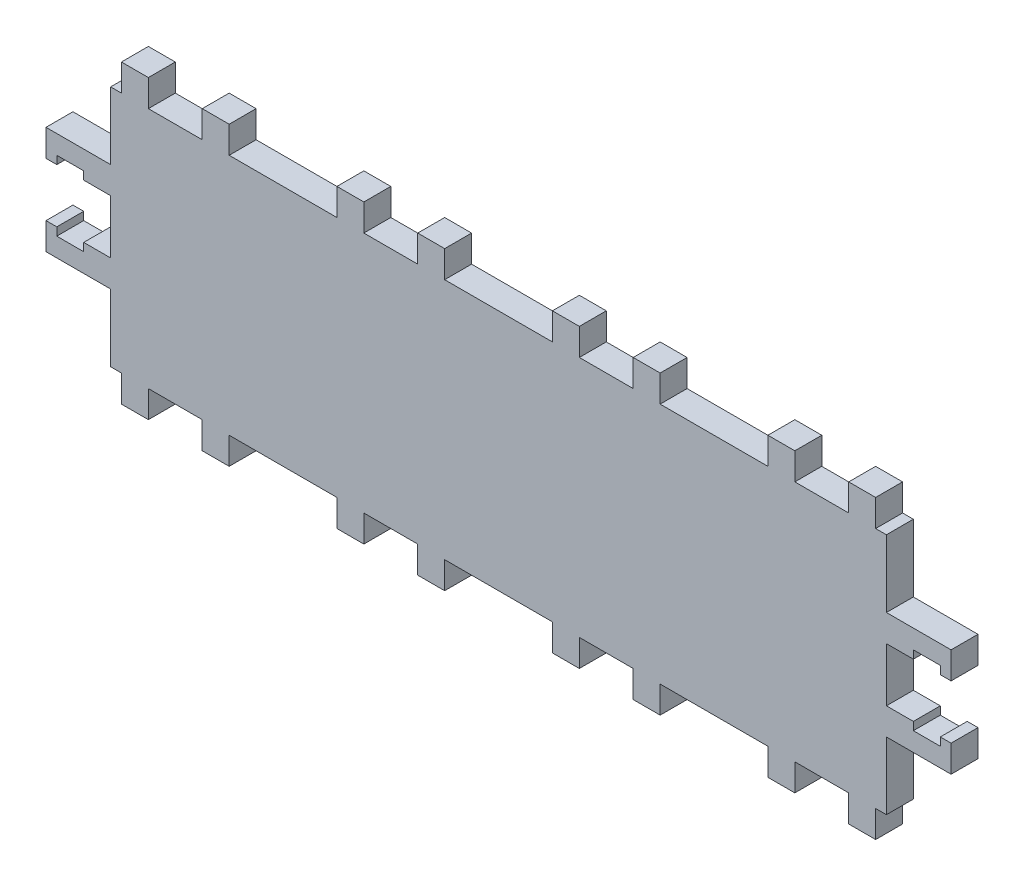
from build123d import *

# Parameters (mm, degrees)
BOSS_EXTRU_1_DEPTH = 5


with BuildPart() as part:
    # Esquisse1 → Boss.-Extru.1 (new body)
    with BuildSketch(Plane.XY):
        Polygon((-72, 12.5), (-72, 0), (-70, 0), (-70, -5), (-65, -5), (-65, 0), (-60, 0), (-55, 0), (-55, -5), (-50, -5), (-50, 0), (-30, 0), (-30, -5), (-25, -5), (-25, 0), (-20, 0), (-15, 0), (-15, -5), (-10, -5), (-10, 0), (10, 0), (10, -5), (15, -5), (15, 0), (20, 0), (25, 0), (25, -5), (30, -5), (30, 0), (50, 0), (50, -5), (55, -5), (55, 0), (60, 0), (65, 0), (65, -5), (70, -5), (70, 0), (72, 0), (72, 12.5), (77, 12.5), (84, 12.5), (84, 17.5), (82, 17.5), (82, 16), (77, 16), (77, 17.5), (72, 17.5), (72, 22.5), (72, 27.5), (77, 27.5), (77, 29), (82, 29), (82, 27.5), (84, 27.5), (84, 32.5), (77, 32.5), (72, 32.5), (72, 45), (70, 45), (70, 50), (65, 50), (65, 45), (60, 45), (55, 45), (55, 50), (50, 50), (50, 45), (30, 45), (30, 50), (25, 50), (25, 45), (20, 45), (15, 45), (15, 50), (10, 50), (10, 45), (-10, 45), (-10, 50), (-15, 50), (-15, 45), (-20, 45), (-25, 45), (-25, 50), (-30, 50), (-30, 45), (-50, 45), (-50, 50), (-55, 50), (-55, 45), (-60, 45), (-65, 45), (-65, 50), (-70, 50), (-70, 45), (-72, 45), (-72, 32.5), (-77, 32.5), (-84, 32.5), (-84, 27.5), (-82, 27.5), (-82, 29), (-77, 29), (-77, 27.5), (-72, 27.5), (-72, 22.5), (-72, 17.5), (-77, 17.5), (-77, 16), (-82, 16), (-82, 17.5), (-84, 17.5), (-84, 12.5), (-77, 12.5), align=None)
    extrude(amount=BOSS_EXTRU_1_DEPTH)


solid = part.part
